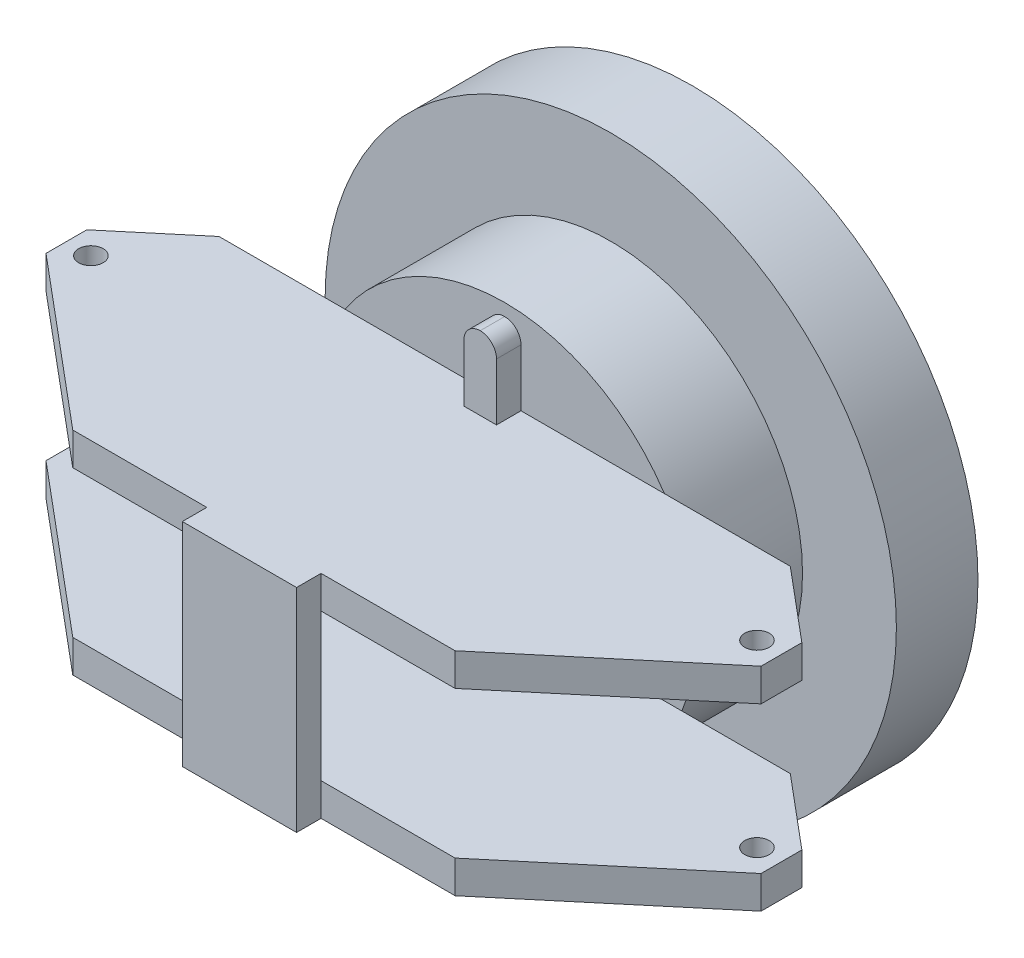
from build123d import *

# Parameters (mm, degrees)
SKETCH1_R               = 35
BOSS_EXTRUDE1_DEPTH     = 10
SKETCH2_R               = 23.5
BOSS_EXTRUDE2_DEPTH     = 13
BOSS_EXTRUDE3_DEPTH     = 4
SKETCH4_R               = 1.5
CUT_EXTRUDE1_DEPTH      = 4
MIRROR2_COPY_1_SKETCH_R = 1.5
MIRROR2_COPY_1_DEPTH    = 4
BOSS_EXTRUDE4_DEPTH     = 3
FILLET1_R               = 2
FILLET1_OF_MIRROR3_R    = 2
SKETCH6_W               = 14
SKETCH6_H               = 26
BOSS_EXTRUDE5_DEPTH     = 3
SKETCH7_R               = 10
CUT_EXTRUDE3_DEPTH      = 10


with BuildPart() as part:
    # Sketch1 → Boss-Extrude1 (new body)
    with BuildSketch(Plane.XY):
        Circle(SKETCH1_R)
    extrude(amount=BOSS_EXTRUDE1_DEPTH)

    # Sketch2 → Boss-Extrude2 (add)
    with BuildSketch(Plane.XY.offset(10)):
        with Locations(Location((0, 0, 0), (0, 0, 180))):
            Circle(SKETCH2_R)
    extrude(amount=BOSS_EXTRUDE2_DEPTH)

    # Sketch3 → Boss-Extrude3 (add)
    with BuildSketch(Plane(origin=(0, 13, 0), x_dir=(1, 0, 0), z_dir=(0, 1, 0))):
        Polygon((35, -23), (-35, -23), (-43.809511096, -30.392057511), (-43.809511096, -35.392057511), (-23.422250333, -52.499000499), (23.422250333, -52.499000499), (43.809511096, -35.392057511), (43.809511096, -30.392057511), align=None)
    boss_extrude3 = extrude(amount=-BOSS_EXTRUDE3_DEPTH)

    # Sketch4 → Cut-Extrude1 (cut)
    with BuildSketch(Plane(origin=(0, 13, 0), x_dir=(1, 0, 0), z_dir=(0, 1, 0))):
        with Locations(Location((-40.809511096, -32.892057511, 0), (0, 0, 270))):
            Circle(SKETCH4_R)
    cut_extrude1 = extrude(amount=-CUT_EXTRUDE1_DEPTH, mode=Mode.SUBTRACT)

    # Mirror1: Cut-Extrude1 across plane
    add(cut_extrude1.mirror(Plane(origin=(0, 0, 0), x_dir=(0, 0, 1), z_dir=(1, 0, 0))), mode=Mode.SUBTRACT)

    # Mirror2: Boss-Extrude3, Cut-Extrude1 across plane
    add(boss_extrude3.mirror(Plane.ZX))
    add(cut_extrude1.mirror(Plane.ZX), mode=Mode.SUBTRACT)

    # Mirror2 copy 1 sketch → Mirror2 copy 1 (cut)
    with BuildSketch(Plane(origin=(0, -13, 0), x_dir=(-1, 0, 0), z_dir=(0, -1, 0))):
        with Locations(Location((-40.809511096, -32.892057511, 0), (0, 0, 270))):
            Circle(MIRROR2_COPY_1_SKETCH_R)
    extrude(amount=-MIRROR2_COPY_1_DEPTH, mode=Mode.SUBTRACT)

    # Sketch5 → Boss-Extrude4 (add)
    with BuildSketch(Plane.XY.offset(23)):
        Polygon((0, -13), (2, -13), (2, -22), (0, -22), (-2, -22), (-2, -13), align=None)
    boss_extrude4 = extrude(amount=BOSS_EXTRUDE4_DEPTH)

    # Fillet1
    fillet1_edges = [part.edges().sort_by_distance(p)[0] for p in [
        (-2, -22, 24.5),
        (2, -22, 24.5),
    ]]
    fillet(fillet1_edges, radius=FILLET1_R - 0.0001)  # a hair under: the kernel refuses the full size

    # Mirror3: Boss-Extrude4 across plane
    add(boss_extrude4.mirror(Plane.ZX))

    # Fillet1 of Mirror3
    fillet1_of_mirror3_edges = [part.edges().sort_by_distance(p)[0] for p in [
        (-2, 22, 24.5),
        (2, 22, 24.5),
    ]]
    fillet(fillet1_of_mirror3_edges, radius=FILLET1_OF_MIRROR3_R - 0.0001)  # a hair under: the kernel refuses the full size

    # Sketch6 → Boss-Extrude5 (add)
    with BuildSketch(Plane.XY.offset(52.499000499)):
        Rectangle(SKETCH6_W, SKETCH6_H)
    extrude(amount=BOSS_EXTRUDE5_DEPTH)

    # Sketch7 → Cut-Extrude3 (cut)
    with BuildSketch(Plane(origin=(0, 0, 0), x_dir=(-1, 0, 0), z_dir=(0, 0, -1))):
        Circle(SKETCH7_R)
    extrude(amount=-CUT_EXTRUDE3_DEPTH, mode=Mode.SUBTRACT)


solid = part.part
